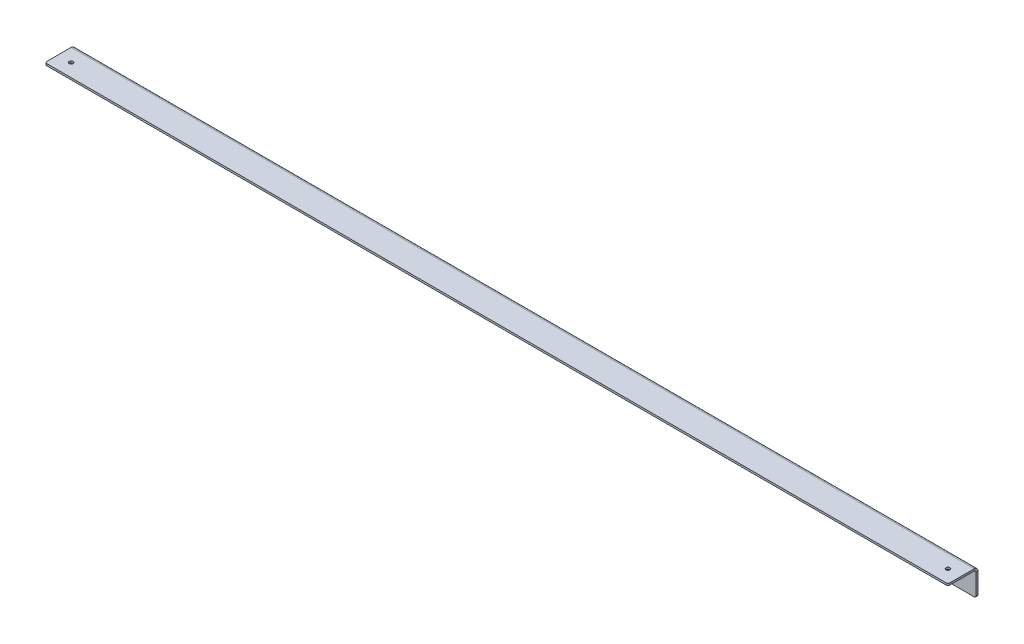
from build123d import *

# Parameters (mm, degrees)
SKETCH3_W               = 1530.35
SKETCH3_H               = 44.45
BASE_FLANGE1_DEPTH      = 3.2639
EDGE_FLANGE1_DEPTH      = 1530.35
F_1_4_CLEARANCE_HOLE1_D = 6.7564
FILLET1_R               = 3.175


# Sheet-metal steps are written as plain solids
with BuildPart() as part:
    # Sketch3 → Base-Flange1 (new body)
    with BuildSketch(Plane(origin=(0, 0, 0), x_dir=(1, 0, 0), z_dir=(0, 1, 0))):
        with Locations((765.175, 22.225)):
            Rectangle(SKETCH3_W, SKETCH3_H)
    extrude(amount=-BASE_FLANGE1_DEPTH)

    # Edge-Flange1 section (across the edge) → Edge-Flange1 (add)
    with BuildSketch(Plane(origin=(0, -3.2639, -47.625), x_dir=(0, 0, 1), z_dir=(1, 0, 0))):
        with BuildLine():
            Line((-3.2639, 3.175), (-3.2639, 41.1861))
            Line((-3.2639, 41.1861), (0, 41.1861))
            Line((0, 41.1861), (0, 3.175))
            ThreePointArc((0, 3.175), (0.92993597, 0.92993597), (3.175, 0))
            Line((3.175, 0), (3.175, -3.2639))
            ThreePointArc((3.175, -3.2639), (-1.377989853, -1.377989853), (-3.2639, 3.175))
        make_face()
    extrude(amount=EDGE_FLANGE1_DEPTH)

    # 1/4 Clearance Hole1 (through all)
    with Locations(Plane(origin=(0, 0, 0), x_dir=(1, 0, 0), z_dir=(0, 1, 0))):
        with Locations((22.225, 22.225), (1508.125, 22.225)):
            Hole(F_1_4_CLEARANCE_HOLE1_D / 2)

    # Fillet1
    fillet1_edges = [part.edges().sort_by_distance(p)[0] for p in [
        (0, -44.45, -49.25695),
        (1530.35, -44.45, -49.25695),
        (1530.35, -1.63195, 0),
        (0, -1.63195, 0),
    ]]
    fillet(fillet1_edges, radius=FILLET1_R)


solid = part.part
